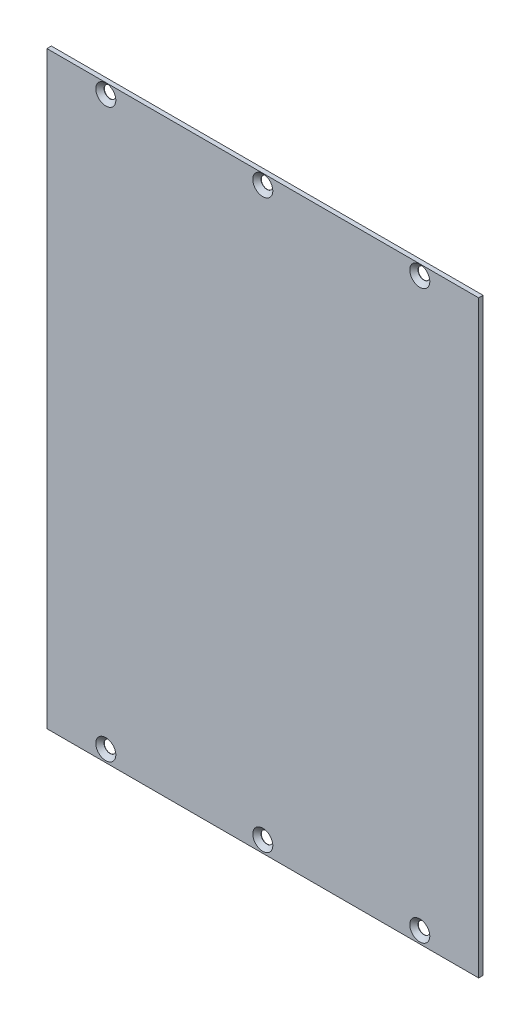
from build123d import *

# Parameters (mm, degrees)
SKETCH_1_W          = 146.6
SKETCH_1_H          = 200
EXTRUDE_1_DEPTH     = 1.5
SKETCH_2_R          = 2
CUT_EXTRUDE_1_DEPTH = 248.979454794
CHAMFER_1_SIZE      = 1.4


with BuildPart() as part:
    # Эскиз1 → Бобышка-Вытянуть1 (new body)
    with BuildSketch(Plane.XY):
        with Locations((73.3, 100)):
            Rectangle(SKETCH_1_W, SKETCH_1_H)
    extrude(amount=EXTRUDE_1_DEPTH)

    # Эскиз2 → Вырез-Вытянуть1 (cut, through all)
    with BuildSketch(Plane.XY.offset(1.5)):
        with Locations((20, 4)):
            Circle(SKETCH_2_R)
        with Locations((20, 196.5)):
            Circle(SKETCH_2_R)
        with Locations((73.3, 196.5)):
            Circle(SKETCH_2_R)
        with Locations((73.3, 4)):
            Circle(SKETCH_2_R)
        with Locations((126.6, 196.5)):
            Circle(SKETCH_2_R)
        with Locations((126.6, 4)):
            Circle(SKETCH_2_R)
    extrude(amount=-CUT_EXTRUDE_1_DEPTH, mode=Mode.SUBTRACT)

    # Фаска1
    chamfer_1_edges = [part.edges().sort_by_distance(p)[0] for p in [
        (124.6, 196.5, 1.5),
        (71.3, 196.5, 1.5),
        (18, 196.5, 1.5),
        (124.6, 4, 1.5),
        (71.3, 4, 1.5),
        (18, 4, 1.5),
    ]]
    chamfer(chamfer_1_edges, length=CHAMFER_1_SIZE)


solid = part.part
